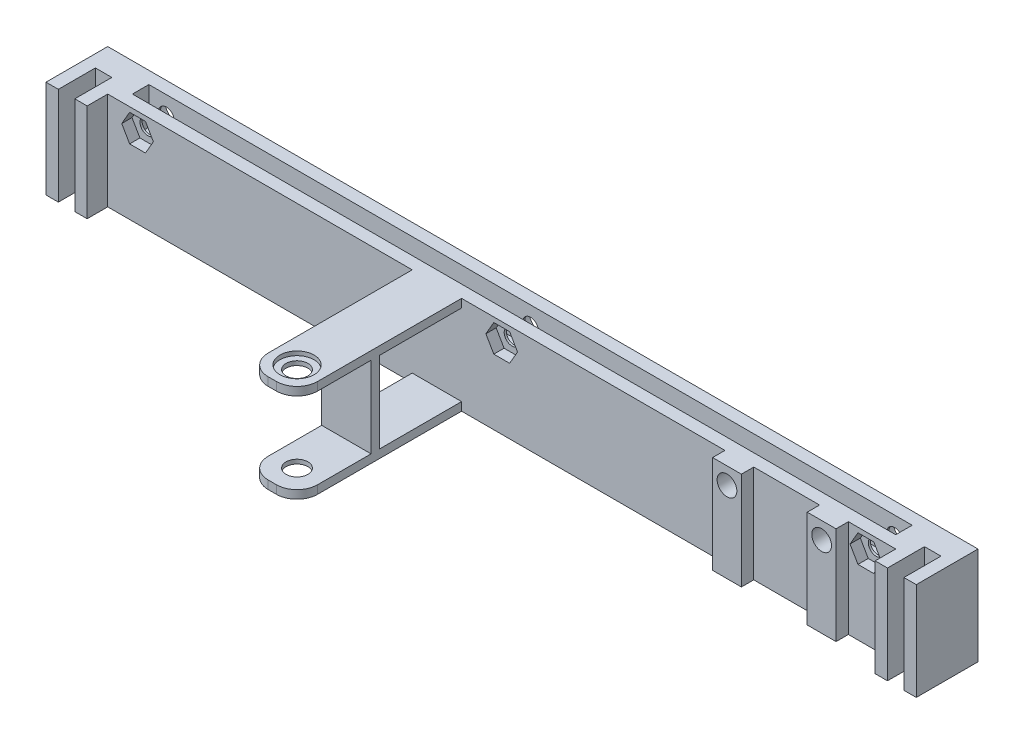
from build123d import *

# Parameters (mm, degrees)
SKETCH2_W            = 23.75
SKETCH2_H            = 12
BOSS_EXTRUDE1_DEPTH  = 10
SKETCH3_W            = 12
SKETCH3_H            = 2.025
BOSS_EXTRUDE2_DEPTH  = 40
FILLET1_R            = 5
FILLET1_OF_MIRROR1_R = 5
SKETCH5_R            = 2.65
CUT_EXTRUDE1_DEPTH   = 57.639760769
SKETCH6_R            = 4.15
CUT_EXTRUDE2_DEPTH   = 1
SKETCH7_W            = 84
SKETCH7_H            = 23.75
SKETCH7_W_2          = 115.5
BOSS_EXTRUDE3_DEPTH  = 10
SKETCH8_W            = 10
SKETCH8_H            = 23.75
BOSS_EXTRUDE4_DEPTH  = 5
BOSS_EXTRUDE7_REACH  = 129.719
SKETCH18_W           = 12
SKETCH18_H           = 2
SKETCH11_W           = 185.5
SKETCH11_H           = 4
CUT_EXTRUDE3_DEPTH   = 9
SKETCH12_R           = 1.9
CUT_EXTRUDE4_DEPTH   = 155.807138078
SKETCH15_R           = 3.35
CUT_EXTRUDE5_DEPTH   = 2.5
SKETCH16_R           = 1.9
CUT_EXTRUDE6_DEPTH   = 2.5
LPATTERN1_COUNT      = 3
LPATTERN1_PITCH      = 88.5
SKETCH14_W           = 7
SKETCH14_H           = 23.75
BOSS_EXTRUDE6_DEPTH  = 3
CUT_EXTRUDE7_REACH   = 130.079
SKETCH21_W           = 4
SKETCH21_H           = 9
LPATTERN2_COUNT      = 2
LPATTERN2_PITCH      = 201.5
SKETCH22_R           = 2.4
CUT_EXTRUDE8_DEPTH   = 3.8
LPATTERN3_COUNT      = 2
LPATTERN3_PITCH      = 23


with BuildPart() as part:
    # Sketch2 → Boss-Extrude1 (new body)
    with BuildSketch(Plane(origin=(0, 0, 0), x_dir=(0, 1, 0), z_dir=(0, 0, 1))):
        with Locations((-83.125, 6)):
            Rectangle(SKETCH2_W, SKETCH2_H)
    extrude(amount=BOSS_EXTRUDE1_DEPTH)

    # Sketch3 → Boss-Extrude2 (add)
    with BuildSketch(Plane.XY.offset(10)):
        with Locations((-6, -72.2625)):
            Rectangle(SKETCH3_W, SKETCH3_H)
    boss_extrude2 = extrude(amount=BOSS_EXTRUDE2_DEPTH)

    # Fillet1
    fillet1_edges = [part.edges().sort_by_distance(p)[0] for p in [
        (0, -72.2625, 50),
        (-12, -72.2625, 50),
    ]]
    fillet(fillet1_edges, radius=FILLET1_R)

    # Mirror1: Boss-Extrude2 across plane
    add(boss_extrude2.mirror(Plane.ZX.offset(-83.125)))

    # Fillet1 of Mirror1
    fillet1_of_mirror1_edges = [part.edges().sort_by_distance(p)[0] for p in [
        (0, -93.9875, 50),
        (-12, -93.9875, 50),
    ]]
    fillet(fillet1_of_mirror1_edges, radius=FILLET1_OF_MIRROR1_R)

    # Sketch5 → Cut-Extrude1 (cut, through all)
    with BuildSketch(Plane.XZ.offset(95)):
        with Locations((-6, 44)):
            Circle(SKETCH5_R)
    extrude(amount=-CUT_EXTRUDE1_DEPTH, mode=Mode.SUBTRACT)

    # Sketch6 → Cut-Extrude2 (cut)
    with BuildSketch(Plane.XZ.offset(95)):
        with Locations((-6, 44)):
            Circle(SKETCH6_R)
    cut_extrude2 = extrude(amount=-CUT_EXTRUDE2_DEPTH, mode=Mode.SUBTRACT)

    # Mirror2: Cut-Extrude2 across plane
    add(cut_extrude2.mirror(Plane.ZX.offset(-83.125)), mode=Mode.SUBTRACT)

    # Sketch7 → Boss-Extrude3 (add)
    with BuildSketch(Plane(origin=(0, 0, 0), x_dir=(1, 0, 0), z_dir=(0, 0, -1))):
        with Locations((-54, 83.125)):
            Rectangle(SKETCH7_W, SKETCH7_H)
        with Locations((57.75, 83.125)):
            Rectangle(SKETCH7_W_2, SKETCH7_H)
    extrude(amount=-BOSS_EXTRUDE3_DEPTH)

    # Sketch8 → Boss-Extrude4 (add)
    with BuildSketch(Plane.XY.offset(10)):
        with Locations((110.5, -83.125)):
            Rectangle(SKETCH8_W, SKETCH8_H)
        with Locations((-91, -83.125)):
            Rectangle(SKETCH8_W, SKETCH8_H)
    extrude(amount=BOSS_EXTRUDE4_DEPTH)

    # Sketch18 → Boss-Extrude7 (add, up to next)
    with BuildSketch(Plane(origin=(0, -92.975, 0), x_dir=(-1, 0, 0), z_dir=(0, 1, 0)), mode=Mode.PRIVATE) as boss_extrude7_sk1:
        with Locations((6, 31)):
            Rectangle(SKETCH18_W, SKETCH18_H)
    boss_extrude7_tool1 = extrude(boss_extrude7_sk1.sketch, amount=BOSS_EXTRUDE7_REACH, mode=Mode.PRIVATE) - part.part
    add(boss_extrude7_tool1.solids().sort_by_distance((-6, -92.975, 31))[0])

    # Sketch11 → Cut-Extrude3 (cut)
    with BuildSketch(Plane(origin=(0, -71.25, 0), x_dir=(-1, 0, 0), z_dir=(0, 1, 0))):
        with Locations((-9.75, 5)):
            Rectangle(SKETCH11_W, SKETCH11_H)
    cut_extrude3 = extrude(amount=-CUT_EXTRUDE3_DEPTH, mode=Mode.SUBTRACT)

    # Mirror3: Cut-Extrude3 across plane
    add(cut_extrude3.mirror(Plane.ZX.offset(-83.125)), mode=Mode.SUBTRACT)

    # Sketch12 → Cut-Extrude4 (cut, symmetric)
    with BuildSketch(Plane.XY.offset(10)):
        with Locations((-78.75, -75.75)):
            Circle(SKETCH12_R)
    cut_extrude4 = extrude(amount=CUT_EXTRUDE4_DEPTH, both=True, mode=Mode.SUBTRACT)

    # Sketch15 → Cut-Extrude5 (cut)
    with BuildSketch(Plane.XY):
        with Locations((-78.75, -75.75)):
            Circle(SKETCH15_R)
    cut_extrude5 = extrude(amount=CUT_EXTRUDE5_DEPTH, mode=Mode.SUBTRACT)

    # Sketch16 → Cut-Extrude6 (cut)
    with BuildSketch(Plane.XY.offset(10)):
        Polygon((-80.673205081, -72.418911087), (-82.596410162, -75.75), (-80.673205081, -79.081088913), (-76.826794919, -79.081088913), (-74.903589838, -75.75), (-76.826794919, -72.418911087), align=None)
        with Locations((-78.75, -75.75)):
            Circle(SKETCH16_R, mode=Mode.SUBTRACT)
    cut_extrude6 = extrude(amount=-CUT_EXTRUDE6_DEPTH, mode=Mode.SUBTRACT)

    # LPattern1: Cut-Extrude4, Cut-Extrude5, Cut-Extrude6 ×3
    with Locations(*[(i * LPATTERN1_PITCH, 0, 0) for i in range(1, LPATTERN1_COUNT)]):
        add(cut_extrude4, mode=Mode.SUBTRACT)
        add(cut_extrude5, mode=Mode.SUBTRACT)
        add(cut_extrude6, mode=Mode.SUBTRACT)

    # Sketch14 → Boss-Extrude6 (add)
    with BuildSketch(Plane.XY.offset(10)):
        with Locations((90.5, -83.125)):
            Rectangle(SKETCH14_W, SKETCH14_H)
        with Locations((67.5, -83.125)):
            Rectangle(SKETCH14_W, SKETCH14_H)
    extrude(amount=BOSS_EXTRUDE6_DEPTH)

    # Sketch21 → Cut-Extrude7 (cut, up to next)
    with BuildSketch(Plane(origin=(0, -71.25, 0), x_dir=(-1, 0, 0), z_dir=(0, 1, 0)), mode=Mode.PRIVATE) as cut_extrude7_sk1:
        with Locations((-110.5, 10.5)):
            Rectangle(SKETCH21_W, SKETCH21_H)
    cut_extrude7_tool1 = extrude(cut_extrude7_sk1.sketch, amount=-CUT_EXTRUDE7_REACH, mode=Mode.PRIVATE) & part.part
    cut_extrude7 = cut_extrude7_tool1.solids().sort_by_distance((110.5, -71.25, 10.5))[0]
    add(cut_extrude7, mode=Mode.SUBTRACT)

    # LPattern2: Cut-Extrude7 ×2
    with Locations(*[(-i * LPATTERN2_PITCH, 0, 0) for i in range(1, LPATTERN2_COUNT)]):
        add(cut_extrude7, mode=Mode.SUBTRACT)

    # Sketch22 → Cut-Extrude8 (cut)
    with BuildSketch(Plane.XY.offset(13)):
        with Locations((90.5, -75.37)):
            Circle(SKETCH22_R)
    cut_extrude8 = extrude(amount=-CUT_EXTRUDE8_DEPTH, mode=Mode.SUBTRACT)

    # LPattern3: Cut-Extrude8 ×2
    with Locations(*[(-i * LPATTERN3_PITCH, 0, 0) for i in range(1, LPATTERN3_COUNT)]):
        add(cut_extrude8, mode=Mode.SUBTRACT)


solid = part.part
